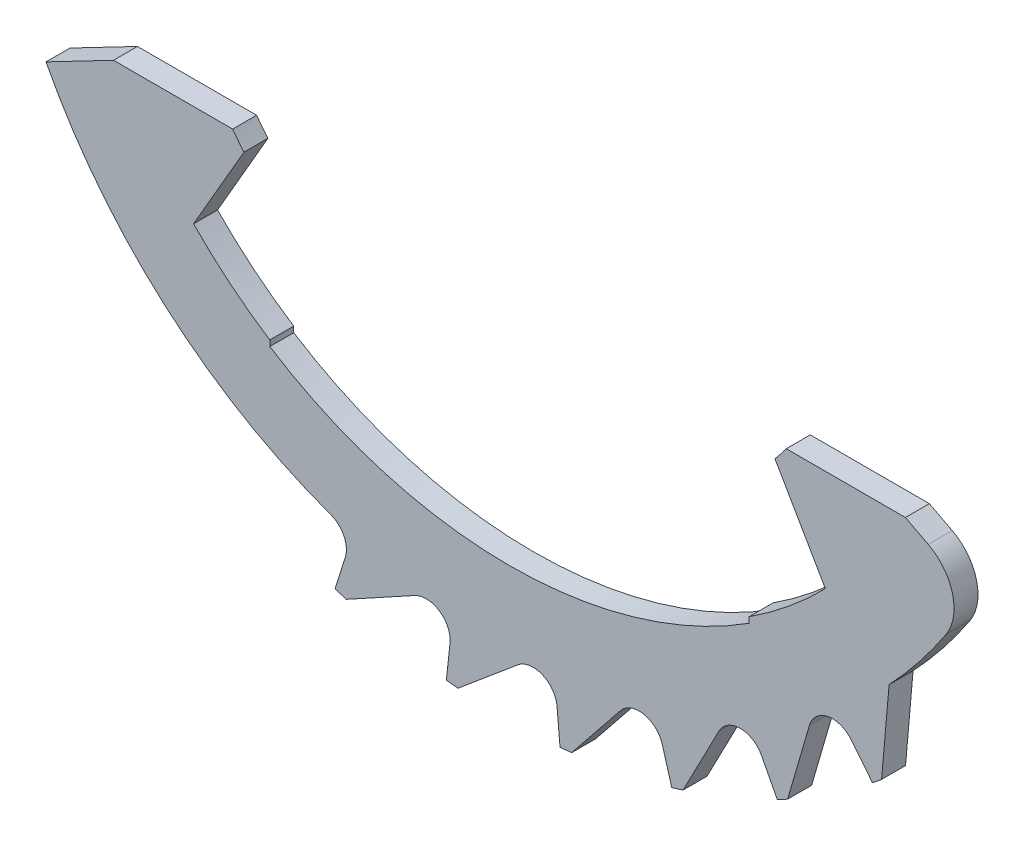
from build123d import *

# Parameters (mm, degrees)
OTHER_10076_5_DEPTH = 0.5
CUT_EXTRUDE1_START  = -0.5
CUT_EXTRUDE1_DEPTH  = 0.5


# Read off the part's stored shape, not the designer's step: 10076-5
with BuildPart() as part:
    # Other 10076-5 outline → Other 10076-5 (new body)
    with BuildSketch(Plane.XY):
        with BuildLine():
            ThreePointArc((7.573674013, -9.436602245), (7.668819519, -9.359444812), (7.763179028, -9.281328104))
            Line((7.763179028, -9.281328104), (7.919995926, -7.488902759))
            ThreePointArc((7.919995926, -7.488902759), (8.548470738, -6.76266575), (9.110578105, -5.983925684))
            ThreePointArc((9.110578105, -5.983925684), (9.242448569, -5.182849851), (8.736493865, -4.547930843))
            Line((8.736493865, -4.547930843), (8.260223146, -4.3))
            Line((8.260223146, -4.3), (5.774945887, -4.3))
            ThreePointArc((5.774945887, -4.3), (5.659072475, -4.451392897), (5.53923133, -4.5996648))
            Line((5.53923133, -4.5996648), (6.59, -6.419649523))
            ThreePointArc((6.59, -6.419649523), (5.831509763, -7.1157216), (5, -7.722693831))
            Line((5, -7.722693831), (5, -7.841555968))
            ThreePointArc((5, -7.841555968), (0, -9.3), (-5, -7.841555968))
            Line((-5, -7.841555968), (-5, -7.722693831))
            ThreePointArc((-5, -7.722693831), (-5.831509763, -7.1157216), (-6.59, -6.419649523))
            Line((-6.59, -6.419649523), (-5.53923133, -4.5996648))
            ThreePointArc((-5.53923133, -4.5996648), (-5.659072475, -4.451392897), (-5.774945887, -4.3))
            Line((-5.774945887, -4.3), (-8.260223146, -4.3))
            Line((-8.260223146, -4.3), (-10.732831081, -5.58715822))
            ThreePointArc((-10.732831081, -5.58715822), (-10.675718173, -5.6955282), (-10.617511084, -5.803314431))
            Line((-10.617511084, -5.803314431), (-9.055174855, -6.258693914))
            ThreePointArc((-9.055174855, -6.258693914), (-8.704696722, -6.64117368), (-8.882127626, -7.128661083))
            Line((-8.882127626, -7.128661083), (-9.436602245, -7.573674013))
            ThreePointArc((-9.436602245, -7.573674013), (-9.359444812, -7.668819519), (-9.281328104, -7.763179028))
            Line((-9.281328104, -7.763179028), (-7.660171598, -7.905011844))
            ThreePointArc((-7.660171598, -7.905011844), (-7.241809703, -8.211767477), (-7.320727248, -8.724502998))
            Line((-7.320727248, -8.724502998), (-7.777730077, -9.269137762))
            ThreePointArc((-7.777730077, -9.269137762), (-7.683493234, -9.347402405), (-7.588468891, -9.424709008))
            Line((-7.588468891, -9.424709008), (-5.970792243, -9.247544602))
            ThreePointArc((-5.970792243, -9.247544602), (-5.500623999, -9.466787654), (-5.477995427, -9.985067155))
            Line((-5.477995427, -9.985067155), (-5.819964104, -10.608393744))
            ThreePointArc((-5.819964104, -10.608393744), (-5.712269322, -10.666769858), (-5.603989074, -10.724052707))
            Line((-5.603989074, -10.724052707), (-4.05195869, -10.234699407))
            ThreePointArc((-4.05195869, -10.234699407), (-3.548052399, -10.358004491), (-3.424747314, -10.861910782))
            Line((-3.424747314, -10.861910782), (-3.638540174, -11.539975104))
            ThreePointArc((-3.638540174, -11.539975104), (-3.521526102, -11.576219327), (-3.404151099, -11.611277074))
            Line((-3.404151099, -11.611277074), (-1.977410637, -10.828540453))
            ThreePointArc((-1.977410637, -10.828540453), (-1.459131136, -10.851169025), (-1.239888083, -11.321337268))
            Line((-1.239888083, -11.321337268), (-1.317289186, -12.028081692))
            ThreePointArc((-1.317289186, -12.028081692), (-1.195452609, -12.04080118), (-1.073493507, -12.052286575))
            Line((-1.073493507, -12.052286575), (0.173128198, -11.006246762))
            ThreePointArc((0.173128198, -11.006246762), (0.685863719, -10.927329218), (0.992619352, -11.345691113))
            Line((0.992619352, -11.345691113), (1.054584487, -12.053955847))
            ThreePointArc((1.054584487, -12.053955847), (1.176561457, -12.042661796), (1.298417839, -12.030133462))
            Line((1.298417839, -12.030133462), (2.317013814, -10.760989181))
            ThreePointArc((2.317013814, -10.760989181), (2.804501216, -10.583558277), (3.186980982, -10.93403641))
            Line((3.186980982, -10.93403641), (3.38593107, -11.616603238))
            ThreePointArc((3.38593107, -11.616603238), (3.503360927, -11.581729673), (3.620431715, -11.545669067))
            Line((3.620431715, -11.545669067), (4.371857887, -10.10219282))
            ThreePointArc((4.371857887, -10.10219282), (4.815363304, -9.833067127), (5.258868721, -10.10219282))
            Line((5.258868721, -10.10219282), (5.58715822, -10.732831081))
            ThreePointArc((5.58715822, -10.732831081), (5.6955282, -10.675718173), (5.803314431, -10.617511084))
            Line((5.803314431, -10.617511084), (6.258693914, -9.055174855))
            ThreePointArc((6.258693914, -9.055174855), (6.64117368, -8.704696722), (7.128661083, -8.882127626))
            Line((7.128661083, -8.882127626), (7.573674013, -9.436602245))
        make_face()
    extrude(amount=OTHER_10076_5_DEPTH)

    # Sketch1 → Cut-Extrude1 (cut)
    with BuildSketch(Plane.XY.offset(0.5).offset(CUT_EXTRUDE1_START)):
        with BuildLine():
            Line((-9.668418082, -5.033059884), (-10.732831081, -5.58715822))
            ThreePointArc((-10.732831081, -5.58715822), (-8.562700768, -8.549278073), (-5.603989074, -10.724052707))
            Line((-5.603989074, -10.724052707), (-4.05195869, -10.234699407))
            ThreePointArc((-4.05195869, -10.234699407), (-3.890638239, -10.211678184), (-3.730482729, -10.241752712))
            ThreePointArc((-3.730482729, -10.241752712), (-7.187854755, -8.19418965), (-9.668418082, -5.033059884))
        make_face()
    extrude(amount=CUT_EXTRUDE1_DEPTH, mode=Mode.SUBTRACT)


solid = part.part
